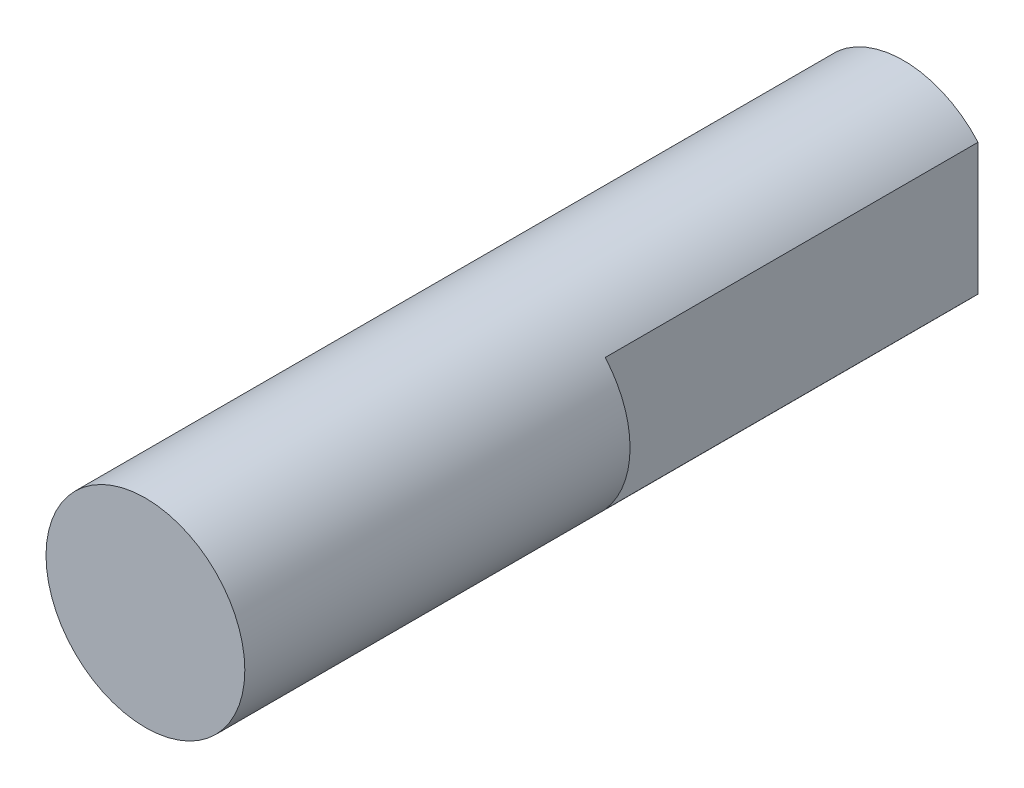
from build123d import *

# Parameters (mm, degrees)
EXTRUDE_1_DEPTH      = 10
EXTRUDE_1_DEPTH_BACK = 20.5
SKETCH_1_R           = 4
CUT_EXTRUDE_1_DEPTH  = 15


with BuildPart() as part:
    # 스케치1 → 보스-돌출1 (new, two sides: drawn at the far end of the back side and taken through both)
    with BuildSketch(Plane.XY.offset(-EXTRUDE_1_DEPTH_BACK)):
        Circle(SKETCH_1_R)
    extrude(amount=EXTRUDE_1_DEPTH + EXTRUDE_1_DEPTH_BACK)

    # 스케치3 → 컷-돌출1 (cut)
    with BuildSketch(Plane(origin=(0, 0, -20.5), x_dir=(-1, 0, 0), z_dir=(0, 0, -1))):
        with BuildLine():
            Line((-3, -2.645751311), (-3, 2.645751311))
            ThreePointArc((-3, 2.645751311), (-4, 0), (-3, -2.645751311))
        make_face()
    extrude(amount=-CUT_EXTRUDE_1_DEPTH, mode=Mode.SUBTRACT)


solid = part.part
